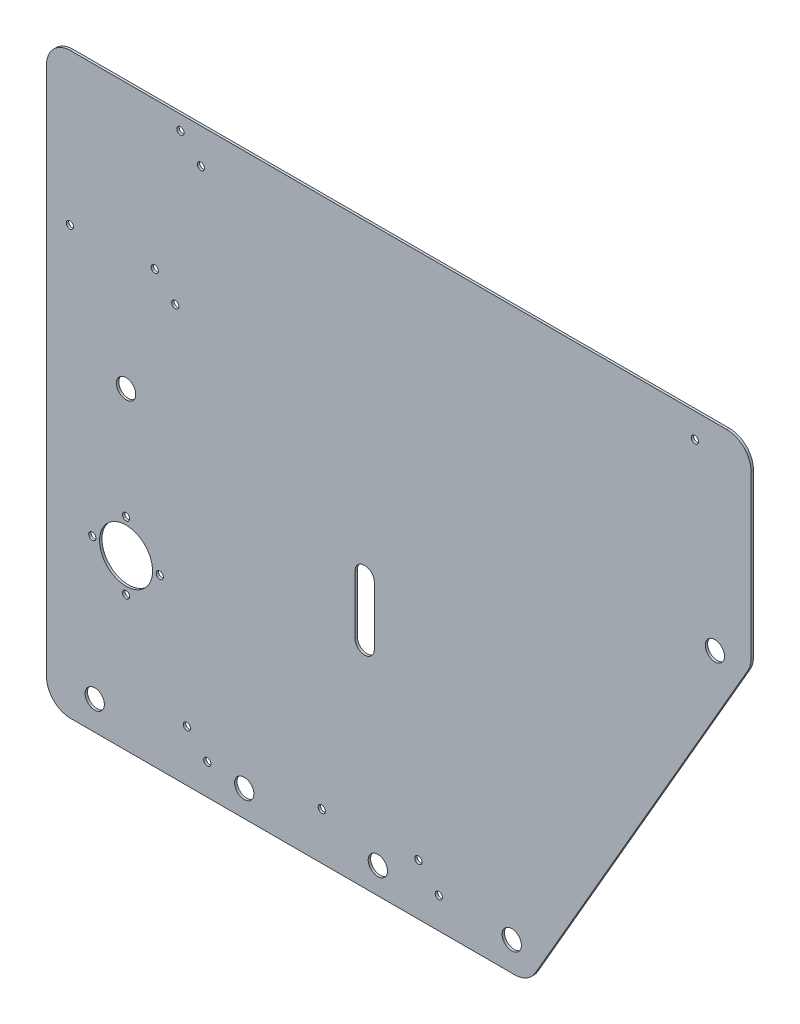
from build123d import *

# Parameters (mm, degrees)
BOSS_EXTRUDE1_DEPTH = 1
SKETCH2_R           = 4
SKETCH2_R_2         = 11
SKETCH2_R_3         = 1.5
CUT_EXTRUDE1_DEPTH  = 3
SKETCH3_W           = 292.37604307
SKETCH3_H           = 50
BOSS_EXTRUDE2_DEPTH = 1
FILLET1_R           = 10
SKETCH4_R           = 1.5
CUT_EXTRUDE2_DEPTH  = 11


with BuildPart() as part:
    # Sketch1 → Boss-Extrude1 (new body)
    with BuildSketch(Plane.XY):
        Polygon((-100, 110), (-100, -80), (100, -80), (192.37604307, 80), (192.37604307, 110), align=None)
    extrude(amount=BOSS_EXTRUDE1_DEPTH)

    # Sketch2 → Cut-Extrude1 (cut)
    with BuildSketch(Plane.XY.offset(1)):
        with Locations((93.07179677, -68)):
            Circle(SKETCH2_R)
        with Locations((177.364936071, 78)):
            Circle(SKETCH2_R)
        with Locations((-67, -10)):
            Circle(SKETCH2_R_2)
        with Locations((-80, -68)):
            Circle(SKETCH2_R)
        with Locations((-53, -10)):
            Circle(SKETCH2_R_3)
        with Locations((-67, 4)):
            Circle(SKETCH2_R_3)
        with Locations((-81, -10)):
            Circle(SKETCH2_R_3)
        with Locations((-67, -24)):
            Circle(SKETCH2_R_3)
        with Locations((62.79605759, -67.242640687)):
            Circle(SKETCH2_R_3)
        with Locations((54.310776216, -58.757359313)):
            Circle(SKETCH2_R_3)
        with Locations((-33.274226936, -67.242640687)):
            Circle(SKETCH2_R_3)
        with Locations((-41.75950831, -58.757359313)):
            Circle(SKETCH2_R_3)
        with Locations((14.225855729, -60.5)):
            Circle(SKETCH2_R_3)
        with Locations((-46.588971723, 90.47428948)):
            Circle(SKETCH2_R_3)
        with Locations((-55.074253097, 98.959570854)):
            Circle(SKETCH2_R_3)
        with Locations((-90.295627115, 97.216930167)):
            Circle(SKETCH2_R_3)
        with Locations((169.055759563, 149.730582757)):
            Circle(SKETCH2_R_3)
        with Locations((-17.947932492, -69.117445741)):
            Circle(SKETCH2_R)
        with Locations((37.494421294, -69.117445741)):
            Circle(SKETCH2_R)
        with Locations((-67, 50)):
            Circle(SKETCH2_R)
        with BuildLine():
            Line((36.026164778, 32), (36.026164778, 7.777585682))
            ThreePointArc((36.026164778, 7.777585682), (32.026164778, 3.777585682), (28.026164778, 7.777585682))
            Line((28.026164778, 7.777585682), (28.026164778, 32))
            ThreePointArc((28.026164778, 32), (32.026164778, 36), (36.026164778, 32))
        make_face()
    extrude(amount=-CUT_EXTRUDE1_DEPTH, mode=Mode.SUBTRACT)

    # Sketch3 → Boss-Extrude2 (add)
    with BuildSketch(Plane.XY.offset(1)):
        with Locations((46.188021535, 135)):
            Rectangle(SKETCH3_W, SKETCH3_H)
    extrude(amount=-BOSS_EXTRUDE2_DEPTH)

    # Fillet1
    fillet1_edges = [part.edges().sort_by_distance(p)[0] for p in [
        (100, -80, 0.5),
        (-100, -80, 0.5),
        (-100, 160, 0.5),
        (192.37604307, 160, 0.5),
        (192.37604307, 80, 0.5),
    ]]
    fillet(fillet1_edges, radius=FILLET1_R)

    # Sketch4 → Cut-Extrude2 (cut)
    with BuildSketch(Plane.XY.offset(1)):
        with Locations((-44.442274409, 153.959570854)):
            Circle(SKETCH4_R)
        with Locations((-35.956993035, 145.47428948)):
            Circle(SKETCH4_R)
        with Locations((169.055759563, 149.730582757)):
            Circle(SKETCH4_R)
    extrude(amount=-CUT_EXTRUDE2_DEPTH, mode=Mode.SUBTRACT)


solid = part.part
